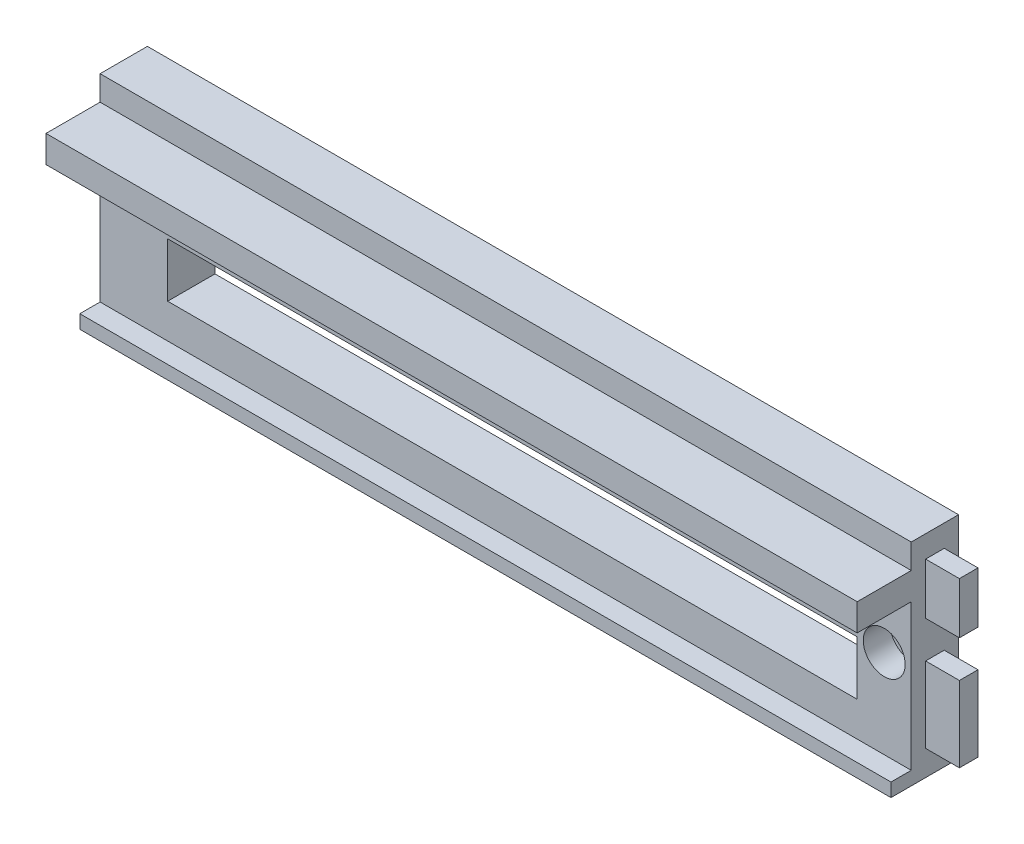
from build123d import *

# Parameters (mm, degrees)
SKETCH1_W               = 120
SKETCH1_H               = 31.25
BOSS_EXTRUDE1_DEPTH     = 7
SKETCH2_W               = 120
SKETCH2_H               = 4
SKETCH2_H_2             = 2
BOSS_EXTRUDE2_DEPTH     = 8
CUT_EXTRUDE1_DEPTH      = 125.260059955
CUT_EXTRUDE1_DEPTH_BACK = 125.260059955
SKETCH3_W               = 102
SKETCH3_H               = 8
SKETCH3_H_2             = 3.5
CUT_EXTRUDE3_REACH      = 126.906
SKETCH6_W               = 5
SKETCH6_H               = 2
SKETCH4_W               = 3
SKETCH4_H               = 8.090611825
SKETCH4_H_2             = 10.659388175
CUT_EXTRUDE4_DEPTH      = 5
SKETCH5_W               = 2.75
SKETCH5_H               = 7.59
SKETCH5_H_2             = 11.2
BOSS_EXTRUDE3_DEPTH     = 5
SKETCH7_R               = 3.1
CUT_EXTRUDE5_DEPTH      = 4
CUT_EXTRUDE6_START      = -1
SKETCH8_R               = 3.1
CUT_EXTRUDE6_DEPTH      = 1
CHAMFER1_SIZE           = 1


with BuildPart() as part:
    # Sketch1 → Boss-Extrude1 (new body)
    with BuildSketch(Plane.XY):
        with Locations((60, 15.625)):
            Rectangle(SKETCH1_W, SKETCH1_H)
    extrude(amount=BOSS_EXTRUDE1_DEPTH)

    # Sketch2 → Boss-Extrude2 (add)
    with BuildSketch(Plane.XY.offset(7)):
        with Locations((60, 25.6)):
            Rectangle(SKETCH2_W, SKETCH2_H)
        with Locations((60, 1)):
            Rectangle(SKETCH2_W, SKETCH2_H_2)
    extrude(amount=BOSS_EXTRUDE2_DEPTH)

    # Sketch3 → Cut-Extrude1 (cut, two sides: drawn at the far end of the back side and taken through both)
    with BuildSketch(Plane.XY.offset(7).offset(-CUT_EXTRUDE1_DEPTH_BACK)):
        with Locations((61, 11.1)):
            Rectangle(SKETCH3_W, SKETCH3_H)
        with Locations((61, 21.85)):
            Rectangle(SKETCH3_W, SKETCH3_H_2)
    extrude(amount=CUT_EXTRUDE1_DEPTH + CUT_EXTRUDE1_DEPTH_BACK, mode=Mode.SUBTRACT)

    # Sketch6 → Cut-Extrude3 (cut, up to next)
    with BuildSketch(Plane.ZY, mode=Mode.PRIVATE) as cut_extrude3_sk1:
        with Locations((12.5, 1)):
            Rectangle(SKETCH6_W, SKETCH6_H)
    cut_extrude3_tool1 = extrude(cut_extrude3_sk1.sketch, amount=-CUT_EXTRUDE3_REACH, mode=Mode.PRIVATE) & part.part
    add(cut_extrude3_tool1.solids().sort_by_distance((0, 1, 12.5))[0], mode=Mode.SUBTRACT)

    # Sketch4 → Cut-Extrude4 (cut)
    with BuildSketch(Plane.ZY):
        with Locations((3.5, 24.204694088)):
            Rectangle(SKETCH4_W, SKETCH4_H)
        with Locations((3.5, 8.829694088)):
            Rectangle(SKETCH4_W, SKETCH4_H_2)
    extrude(amount=-CUT_EXTRUDE4_DEPTH, mode=Mode.SUBTRACT)

    # Sketch5 → Boss-Extrude3 (add)
    with BuildSketch(Plane(origin=(120, 0, 0), x_dir=(0, 0, -1), z_dir=(1, 0, 0))):
        with Locations((-3.5, 24.205)):
            Rectangle(SKETCH5_W, SKETCH5_H)
        with Locations((-3.5, 9.35)):
            Rectangle(SKETCH5_W, SKETCH5_H_2)
    extrude(amount=BOSS_EXTRUDE3_DEPTH)

    # Sketch7 → Cut-Extrude5 (cut)
    with BuildSketch(Plane.XY.offset(7)):
        with Locations((116, 15.1)):
            Circle(SKETCH7_R)
    extrude(amount=-CUT_EXTRUDE5_DEPTH, mode=Mode.SUBTRACT)

    # Sketch8 → Cut-Extrude6 (cut)
    with BuildSketch(Plane(origin=(0, 0, 0), x_dir=(-1, 0, 0), z_dir=(0, 0, -1)).offset(CUT_EXTRUDE6_START)):
        with Locations(Location((-116, 15.1, 0), (0, 0, 180))):
            Circle(SKETCH8_R)
    extrude(amount=CUT_EXTRUDE6_DEPTH, mode=Mode.SUBTRACT)

    # Chamfer1
    chamfer1_edges = [part.edges().sort_by_distance(p)[0] for p in [
        (112.9, 15.1, 1),
    ]]
    chamfer(chamfer1_edges, length=CHAMFER1_SIZE - 0.0001)  # a hair under: the kernel refuses the full size


solid = part.part
